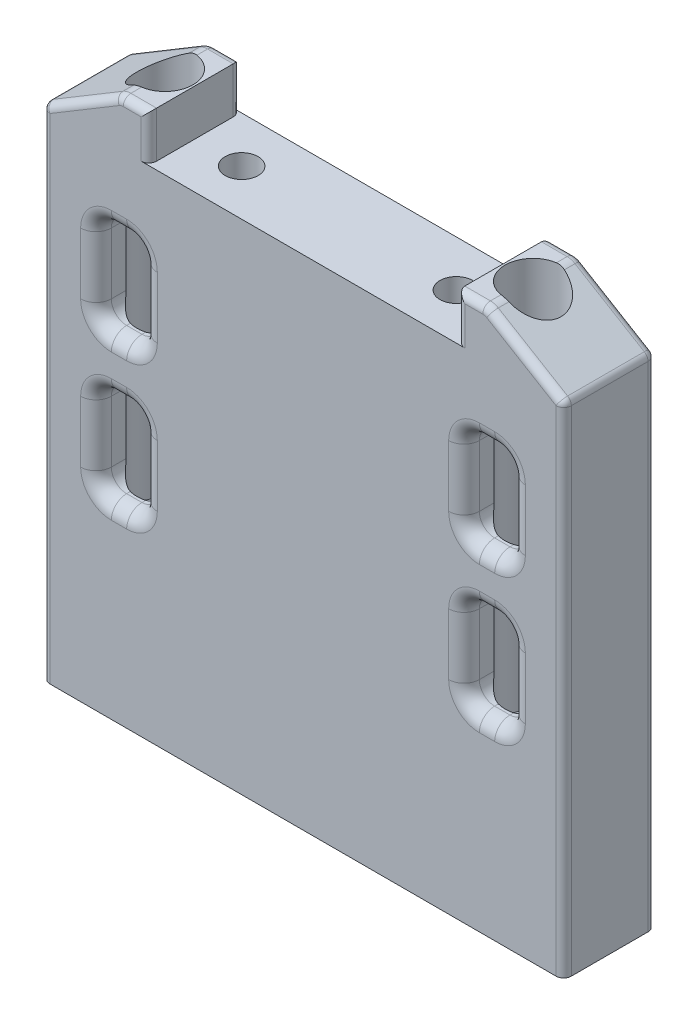
from build123d import *

# Parameters (mm, degrees)
EXTRUDE_1_DEPTH     = 6
SKETCH_2_R          = 2.1
CUT_EXTRUDE_1_DEPTH = 95.260277954
SKETCH_3_R          = 2.15
CUT_EXTRUDE_2_DEPTH = 95.260277954
MOVE_FACE_1_BY      = 0.05
MOVE_FACE_1_2_BY    = 0.05
SKETCH_5_R          = 3.65
CUT_EXTRUDE_4_DEPTH = 45
EXTRUDE_2_REACH     = 96.26
SKETCH_6_W          = 14
SKETCH_6_H          = 12
SKETCH_6_R          = 3.65
EXTRUDE_3_REACH     = 96.26
SKETCH_6_2_W        = 14
SKETCH_6_2_H        = 12
SKETCH_6_2_R        = 3.65
EXTRUDE_START       = 6
SKETCH_7_W          = 13.9
SKETCH_7_H          = 12
SKETCH_7_R          = 3.65
EXTRUDE_4_DEPTH     = 6
CUT_EXTRUDE_5_DEPTH = 100.040395799
SKETCH_9_W          = 6
SKETCH_9_H          = 12
CUT_EXTRUDE_6_DEPTH = 100.040395799
FILLET_1_R          = 2
FILLET_2_R          = 2
FILLET_3_R          = 2
FILLET_4_R          = 1


with BuildPart() as part:
    # 草图1 → 凸台-拉伸1 (new, symmetric)
    with BuildSketch(Plane.XY):
        Polygon((0, 0), (68, 0), (68, 18), (54, 27), (54, 65), (14, 65), (14, 27), (0, 18), align=None)
    extrude(amount=EXTRUDE_1_DEPTH, both=True)

    # 草图2 → 切除-拉伸1 (cut, through all)
    with BuildSketch(Plane(origin=(0, 65, 0), x_dir=(1, 0, 0), z_dir=(0, 1, 0))):
        with Locations(Location((48, 0, 0), (0, 0, 270))):
            Circle(SKETCH_2_R)
        with Locations(Location((20, 0, 0), (0, 0, 270))):
            Circle(SKETCH_2_R)
    extrude(amount=-CUT_EXTRUDE_1_DEPTH, mode=Mode.SUBTRACT)

    # 草图3 → 切除-拉伸2 (cut, through all)
    with BuildSketch(Plane.XZ):
        with Locations(Location((10, 0, 0), (0, 0, 270))):
            Circle(SKETCH_3_R)
        with Locations((58, 0)):
            Circle(SKETCH_3_R)
    extrude(amount=-CUT_EXTRUDE_2_DEPTH, mode=Mode.SUBTRACT)

    # Move Face 1: a curved face moved inward by 0.05
    add(Solid.thicken(part.faces().sort_by_distance((48, 32.5, -2.1))[0], -MOVE_FACE_1_BY), mode=Mode.SUBTRACT)

    # Move Face 1 2: a curved face moved inward by 0.05
    add(Solid.thicken(part.faces().sort_by_distance((20, 32.5, -2.1))[0], -MOVE_FACE_1_2_BY), mode=Mode.SUBTRACT)

    # 草图5 → 切除-拉伸4 (cut)
    with BuildSketch(Plane(origin=(0, 65, 0), x_dir=(1, 0, 0), z_dir=(0, 1, 0))):
        with Locations(Location((10, 0, 0), (0, 0, 270))):
            Circle(SKETCH_5_R)
        with Locations(Location((58, 0, 0), (0, 0, 270))):
            Circle(SKETCH_5_R)
    extrude(amount=-CUT_EXTRUDE_4_DEPTH, mode=Mode.SUBTRACT)

    # 凸台-拉伸2: up to this plane
    extrude_2_end = Plane(origin=(14, 27, 6), z_dir=(0.540757591313499, -0.8411784753765533, 0))
    # 草图6 → 凸台-拉伸2 (add, up to the surface)
    with BuildSketch(Plane(origin=(0, 65, 0), x_dir=(1, 0, 0), z_dir=(0, 1, 0)), mode=Mode.PRIVATE) as extrude_2_sk1:
        with Locations((7, 0)):
            Rectangle(SKETCH_6_W, SKETCH_6_H)
        with Locations(Location((10, 0, 0), (0, 0, 270))):
            Circle(SKETCH_6_R, mode=Mode.SUBTRACT)
    extrude_2_tool1 = split(extrude(extrude_2_sk1.sketch, amount=-EXTRUDE_2_REACH, mode=Mode.PRIVATE), bisect_by=extrude_2_end, keep=Keep.BOTH, mode=Mode.PRIVATE)
    add(extrude_2_tool1.solids().sort_by_distance((6.004634, 65, 0))[0])
    # 草图6 → 凸台-拉伸2 (add, up to the surface)
    with BuildSketch(Plane(origin=(0, 65, 0), x_dir=(1, 0, 0), z_dir=(0, 1, 0)), mode=Mode.PRIVATE) as extrude_2_sk2:
        with Locations((61, 0)):
            Rectangle(SKETCH_6_W, SKETCH_6_H)
        with Locations(Location((58, 0, 0), (0, 0, 270))):
            Circle(SKETCH_6_R, mode=Mode.SUBTRACT)
    extrude_2_tool2 = split(extrude(extrude_2_sk2.sketch, amount=-EXTRUDE_2_REACH, mode=Mode.PRIVATE), bisect_by=extrude_2_end, keep=Keep.BOTH, mode=Mode.PRIVATE)
    add(extrude_2_tool2.solids().sort_by_distance((61.995366, 65, 0))[0])

    # 凸台-拉伸3: up to this face of the body (flat: up to its plane)
    extrude_3_end = Plane(part.part.faces().sort_by_distance((61.995366267, 21.860121685, 0))[0])
    # 草图6<2> → 凸台-拉伸3 (add, up to the picked face)
    with BuildSketch(Plane(origin=(0, 65, 0), x_dir=(1, 0, 0), z_dir=(0, 1, 0)), mode=Mode.PRIVATE) as extrude_3_sk1:
        with Locations((61, 0)):
            Rectangle(SKETCH_6_2_W, SKETCH_6_2_H)
        with Locations(Location((58, 0, 0), (0, 0, 270))):
            Circle(SKETCH_6_2_R, mode=Mode.SUBTRACT)
    extrude_3_tool1 = split(extrude(extrude_3_sk1.sketch, amount=-EXTRUDE_3_REACH, mode=Mode.PRIVATE), bisect_by=extrude_3_end, keep=Keep.BOTH, mode=Mode.PRIVATE)
    add(extrude_3_tool1.solids().sort_by(Axis((61.995366, 65, 0), (0, -1, 0)))[0])

    # 草图7 → 凸台-拉伸4 (add)
    # profile 1 of 2: a face of its own
    with BuildSketch(Plane(origin=(0, 65, 0), x_dir=(1, 0, 0), z_dir=(0, 1, 0)).offset(EXTRUDE_START)):
        with Locations((6.95, 0)):
            Rectangle(SKETCH_7_W, SKETCH_7_H)
        with Locations(Location((10, 0, 0), (0, 0, 270))):
            Circle(SKETCH_7_R, mode=Mode.SUBTRACT)
    # profile 2 of 2: a face of its own
    with BuildSketch(Plane(origin=(0, 65, 0), x_dir=(1, 0, 0), z_dir=(0, 1, 0)).offset(EXTRUDE_START)):
        with Locations((61.05, 0)):
            Rectangle(SKETCH_7_W, SKETCH_7_H)
        with Locations(Location((58, 0, 0), (0, 0, 270))):
            Circle(SKETCH_7_R, mode=Mode.SUBTRACT)
    extrude(amount=-EXTRUDE_4_DEPTH)

    # 草图8 → 切除-拉伸5 (cut, through all)
    with BuildSketch(Plane.XY.offset(6)):
        Polygon((0, 71), (0, 65), (10, 71), align=None)
        Polygon((68, 71), (58, 71), (68, 65), align=None)
    extrude(amount=-CUT_EXTRUDE_5_DEPTH, mode=Mode.SUBTRACT)

    # 草图9 → 切除-拉伸6 (cut, through all)
    with BuildSketch(Plane.XY.offset(6)):
        with Locations((10, 49.5)):
            Rectangle(SKETCH_9_W, SKETCH_9_H)
        with Locations((58, 49.5)):
            Rectangle(SKETCH_9_W, SKETCH_9_H)
        with Locations((58, 30.5)):
            Rectangle(SKETCH_9_W, SKETCH_9_H)
        with Locations((10, 30.5)):
            Rectangle(SKETCH_9_W, SKETCH_9_H)
    extrude(amount=-CUT_EXTRUDE_6_DEPTH, mode=Mode.SUBTRACT)

    # 圆角1
    fillet_1_edges = [part.edges().sort_by_distance(p)[0] for p in [
        (55, 43.5, 4.039531144),
        (55, 43.5, -4.039531144),
        (55, 55.5, -4.039531144),
        (55, 55.5, 4.039531144),
        (61, 55.5, -4.039531144),
        (61, 55.5, 4.039531144),
        (61, 43.5, 4.039531144),
        (61, 43.5, -4.039531144),
        (13, 36.5, -4.039531144),
        (13, 36.5, 4.039531144),
        (13, 24.5, 4.039531144),
        (13, 24.5, -4.039531144),
        (7, 24.5, 4.039531144),
        (7, 24.5, -4.039531144),
        (7, 36.5, -4.039531144),
        (7, 36.5, 4.039531144),
        (55, 36.5, -4.039531144),
        (55, 36.5, 4.039531144),
        (61, 36.5, -4.039531144),
        (61, 36.5, 4.039531144),
        (61, 24.5, -4.039531144),
        (61, 24.5, 4.039531144),
        (55, 24.5, 4.039531144),
        (55, 24.5, -4.039531144),
        (7, 43.5, 4.039531144),
        (7, 43.5, -4.039531144),
        (7, 55.5, -4.039531144),
        (7, 55.5, 4.039531144),
        (13, 55.5, -4.039531144),
        (13, 55.5, 4.039531144),
        (13, 43.5, 4.039531144),
        (13, 43.5, -4.039531144),
    ]]
    fillet(fillet_1_edges, radius=FILLET_1_R)

    # 圆角2
    fillet_2_edges = [part.edges().sort_by_distance(p)[0] for p in [
        (10, 55.5, -6),
        (13, 49.5, -6),
        (10, 43.5, -6),
        (7, 49.5, -6),
        (61, 30.5, -6),
        (58, 24.5, -6),
        (55, 30.5, -6),
        (58, 36.5, -6),
        (10, 24.5, -6),
        (7, 30.5, -6),
        (10, 36.5, -6),
        (13, 30.5, -6),
        (58, 55.5, -6),
        (61, 49.5, -6),
        (58, 43.5, -6),
        (55, 49.5, -6),
        (13, 49.5, 6),
        (10, 43.5, 6),
        (10, 55.5, 6),
        (7, 49.5, 6),
        (55, 30.5, 6),
        (58, 36.5, 6),
        (58, 24.5, 6),
        (61, 30.5, 6),
        (10, 36.5, 6),
        (13, 30.5, 6),
        (7, 30.5, 6),
        (10, 24.5, 6),
        (58, 43.5, 6),
        (55, 49.5, 6),
        (61, 49.5, 6),
        (58, 55.5, 6),
        (12.414213562, 54.914213562, -6),
        (12.414213562, 44.085786438, -6),
        (7.585786438, 54.914213562, -6),
        (60.414213562, 25.085786438, -6),
        (55.585786438, 25.085786438, -6),
        (55.585786438, 35.914213562, -6),
        (60.414213562, 35.914213562, -6),
        (7.585786438, 25.085786438, -6),
        (7.585786438, 35.914213562, -6),
        (12.414213562, 35.914213562, -6),
        (12.414213562, 25.085786438, -6),
        (60.414213562, 54.914213562, -6),
        (60.414213562, 44.085786438, -6),
        (55.585786438, 44.085786438, -6),
        (55.585786438, 54.914213562, -6),
        (7.585786438, 44.085786438, -6),
        (12.414213562, 44.085786438, 6),
        (12.414213562, 54.914213562, 6),
        (7.585786438, 54.914213562, 6),
        (55.585786438, 35.914213562, 6),
        (55.585786438, 25.085786438, 6),
        (60.414213562, 25.085786438, 6),
        (60.414213562, 35.914213562, 6),
        (12.414213562, 35.914213562, 6),
        (7.585786438, 35.914213562, 6),
        (7.585786438, 25.085786438, 6),
        (12.414213562, 25.085786438, 6),
        (55.585786438, 44.085786438, 6),
        (60.414213562, 44.085786438, 6),
        (60.414213562, 54.914213562, 6),
        (55.585786438, 54.914213562, 6),
        (7.585786438, 44.085786438, 6),
    ]]
    fillet(fillet_2_edges, radius=FILLET_2_R)

    # 圆角3
    # the kernel refuses this fillet: 2 mm, written as the material it takes off along each edge
    with BuildSketch(Plane(origin=(58, 71, 7.384919825), x_dir=(0.8574929257125442, -0.5144957554275266, 0), z_dir=(0, 0, -1)), Plane(origin=(58, 71, -2.265080175), x_dir=(0.8574929257125442, -0.5144957554275266, 0), z_dir=(0, 0, -1))) as fillet_3_piece_1:
        with BuildLine():
            CenterArc((FILLET_3_R * 0.276983964948, FILLET_3_R), FILLET_3_R, 239.036243468, 30.963756532)
            Line((-FILLET_3_R * 0.237511790479, FILLET_3_R * 0.142507074287), (0, 0))
            Line((0, 0), (FILLET_3_R * 0.276983964948, 0))
        make_face()
    extrude(amount=5.119839649, mode=Mode.SUBTRACT)
    with BuildSketch(Plane(origin=(10, 71, 7.384919825), x_dir=(-0.8574929257125512, -0.5144957554275147, 0), z_dir=(0, 0, -1)), Plane(origin=(10, 71, -2.265080175), x_dir=(-0.8574929257125512, -0.5144957554275147, 0), z_dir=(0, 0, -1))) as fillet_3_piece_2:
        with BuildLine():
            CenterArc((FILLET_3_R * 0.276983964948, -FILLET_3_R), FILLET_3_R, 90, 30.963756532)
            Line((-FILLET_3_R * 0.237511790479, -FILLET_3_R * 0.142507074287), (0, 0))
            Line((0, 0), (FILLET_3_R * 0.276983964948, 0))
        make_face()
    extrude(amount=5.119839649, mode=Mode.SUBTRACT)

    # 圆角4
    fillet_4_edges = [part.edges().sort_by_distance(p)[0] for p in [
        (68, 32.5, -6),
        (12.226983965, 71, -6),
        (13.9, 68, 6),
        (13.9, 68, -6),
        (55.773016035, 71, 6),
        (54.1, 68, -6),
        (54.1, 68, 6),
        (68, 32.5, 6),
        (0, 32.5, -6),
        (0, 32.5, 6),
        (0, 65, 0),
        (68, 65, 0),
        (55.773016035, 71, -6),
        (63.23751179, 67.857492926, 6),
        (63.23751179, 67.857492926, -6),
        (12.226983965, 71, 6),
        (4.76248821, 67.857492926, 6),
        (10.020100766, 70.927429856, 6),
        (57.979899234, 70.927429856, 6),
        (4.76248821, 67.857492926, -6),
        (10.020100766, 70.927429856, -6),
        (57.979899234, 70.927429856, -6),
    ]]
    fillet(fillet_4_edges, radius=FILLET_4_R)


solid = part.part
